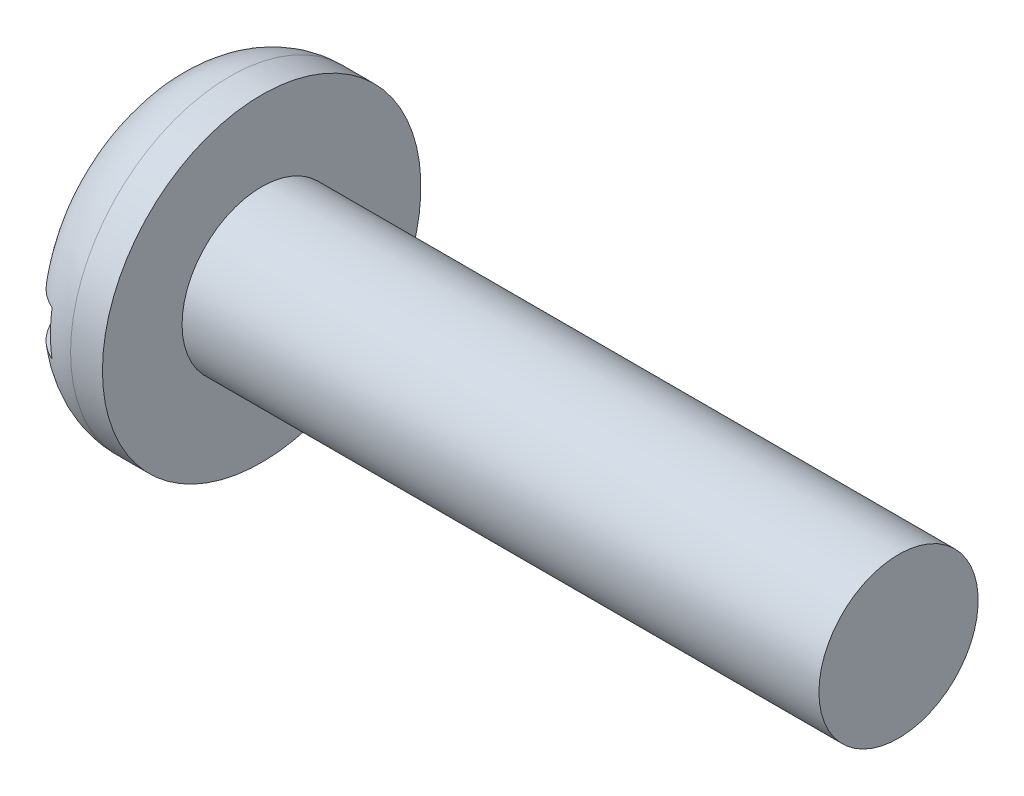
from build123d import *

# Parameters (mm, degrees)
SKETCH2_W  = 20
SKETCH2_H  = 2.8
SLOT_DEPTH = 2.4


with BuildPart() as part:
    # BodySke → Base-Revolve (revolve)
    with BuildSketch(Plane.XY):
        with BuildLine():
            Line((6, 5), (6, 10))
            Line((6, 10), (4, 10))
            ThreePointArc((4, 10), (1.171572875, 8.828427125), (0, 6))
            Line((0, 6), (0, 0))
            Line((0, 0), (46, 0))
            Line((46, 0), (46, 5))
            Line((46, 5), (6, 5))
        make_face()
    revolve(axis=Axis((-25.4, 0, 0), (1, 0, 0)))

    # Sketch2 → Slot (cut)
    with BuildSketch(Plane(origin=(0, 0, 0), x_dir=(0, 0, -1), z_dir=(1, 0, 0))):
        Rectangle(SKETCH2_W, SKETCH2_H)
    extrude(amount=SLOT_DEPTH, mode=Mode.SUBTRACT)


solid = part.part
